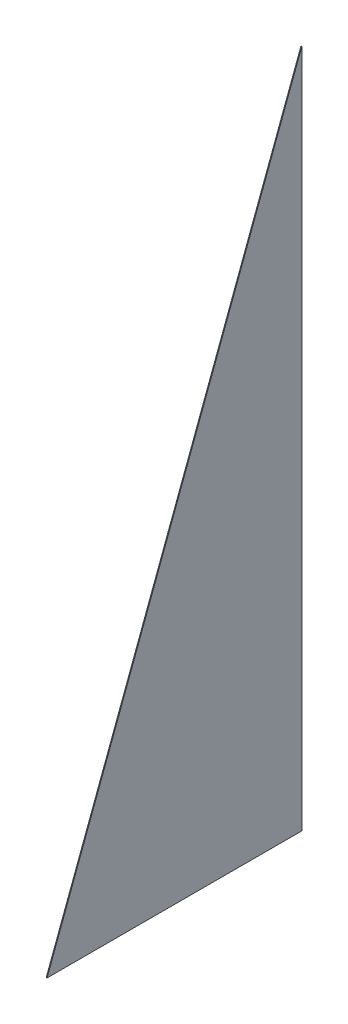
from build123d import *

# Parameters (mm, degrees)
BOSS_EXTRUDE1_DEPTH = 1


with BuildPart() as part:
    # Sketch1 → Boss-Extrude1 (new body)
    with BuildSketch(Plane(origin=(0, 0, 0), x_dir=(0, 0, -1), z_dir=(1, 0, 0))):
        Polygon((0, 0), (0, 800), (-300, 0), align=None)
    extrude(amount=BOSS_EXTRUDE1_DEPTH)


solid = part.part
